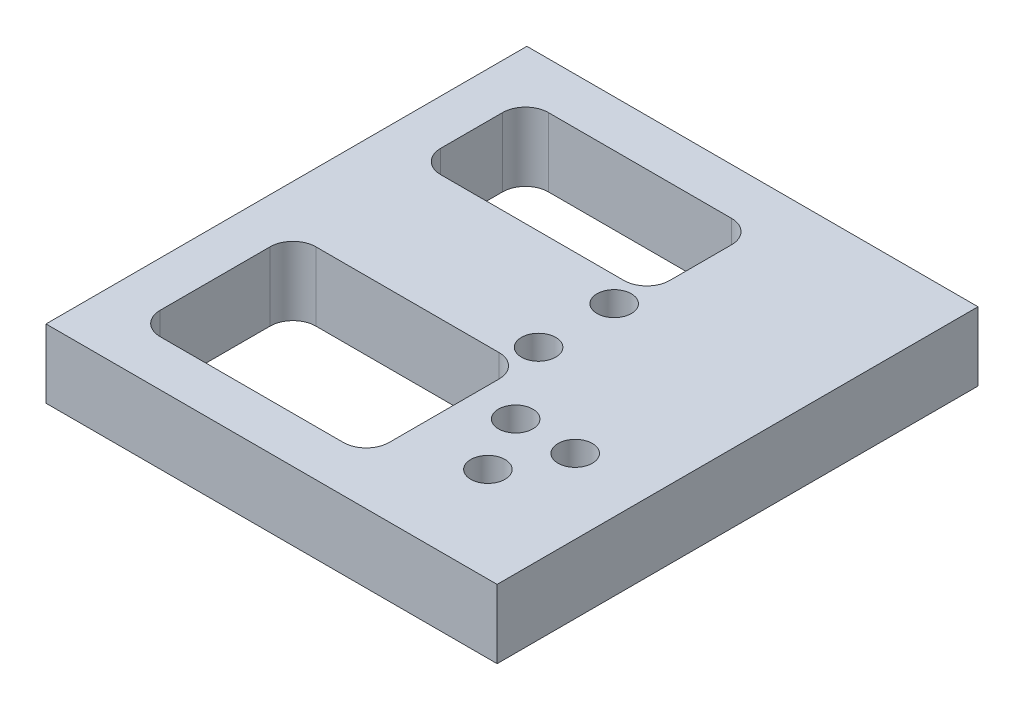
from build123d import *

# Parameters (mm, degrees)
SKETCH1_W           = 197
SKETCH1_H           = 210
BOSS_EXTRUDE1_DEPTH = 30
CUT_EXTRUDE2_REACH  = 149.062
SKETCH3_R           = 7.5
SKETCH4_R           = 9
CUT_EXTRUDE3_DEPTH  = 5


with BuildPart() as part:
    # Sketch1 → Boss-Extrude1 (new body)
    with BuildSketch(Plane(origin=(0, 0, 0), x_dir=(1, 0, 0), z_dir=(0, 1, 0))):
        Rectangle(SKETCH1_W, SKETCH1_H)
    extrude(amount=-BOSS_EXTRUDE1_DEPTH)

    # Sketch3 → Cut-Extrude2 (cut, up to next)
    with BuildSketch(Plane(origin=(0, 0, 0), x_dir=(1, 0, 0), z_dir=(0, 1, 0)), mode=Mode.PRIVATE) as cut_extrude2_sk1:
        with Locations((17.88, 26.73)):
            Circle(SKETCH3_R)
    cut_extrude2_tool1 = extrude(cut_extrude2_sk1.sketch, amount=-CUT_EXTRUDE2_REACH, mode=Mode.PRIVATE) & part.part
    # Sketch3 → Cut-Extrude2 (cut, up to next)
    with BuildSketch(Plane(origin=(0, 0, 0), x_dir=(1, 0, 0), z_dir=(0, 1, 0)), mode=Mode.PRIVATE) as cut_extrude2_sk2:
        with Locations((17.88, -6.27)):
            Circle(SKETCH3_R)
    cut_extrude2_tool2 = extrude(cut_extrude2_sk2.sketch, amount=-CUT_EXTRUDE2_REACH, mode=Mode.PRIVATE) & part.part
    # Sketch3 → Cut-Extrude2 (cut, up to next)
    with BuildSketch(Plane(origin=(0, 0, 0), x_dir=(1, 0, 0), z_dir=(0, 1, 0)), mode=Mode.PRIVATE) as cut_extrude2_sk3:
        with Locations((53, -63.53)):
            Circle(SKETCH3_R)
    cut_extrude2_tool3 = extrude(cut_extrude2_sk3.sketch, amount=-CUT_EXTRUDE2_REACH, mode=Mode.PRIVATE) & part.part
    # Sketch3 → Cut-Extrude2 (cut, up to next)
    with BuildSketch(Plane(origin=(0, 0, 0), x_dir=(1, 0, 0), z_dir=(0, 1, 0)), mode=Mode.PRIVATE) as cut_extrude2_sk4:
        with Locations((66, -38.4)):
            Circle(SKETCH3_R)
    cut_extrude2_tool4 = extrude(cut_extrude2_sk4.sketch, amount=-CUT_EXTRUDE2_REACH, mode=Mode.PRIVATE) & part.part
    # Sketch3 → Cut-Extrude2 (cut, up to next)
    with BuildSketch(Plane(origin=(0, 0, 0), x_dir=(1, 0, 0), z_dir=(0, 1, 0)), mode=Mode.PRIVATE) as cut_extrude2_sk5:
        with Locations((40, -38.4)):
            Circle(SKETCH3_R)
    cut_extrude2_tool5 = extrude(cut_extrude2_sk5.sketch, amount=-CUT_EXTRUDE2_REACH, mode=Mode.PRIVATE) & part.part
    # Sketch3 → Cut-Extrude2 (cut, up to next)
    with BuildSketch(Plane(origin=(0, 0, 0), x_dir=(1, 0, 0), z_dir=(0, 1, 0)), mode=Mode.PRIVATE) as cut_extrude2_sk6:
        with BuildLine():
            Line((-68.745, 84.63), (11.255, 84.63))
            ThreePointArc((11.255, 84.63), (18.326067812, 81.701067812), (21.255, 74.63))
            Line((21.255, 74.63), (21.255, 47.63))
            ThreePointArc((21.255, 47.63), (18.326067812, 40.558932188), (11.255, 37.63))
            Line((11.255, 37.63), (-68.745, 37.63))
            ThreePointArc((-68.745, 37.63), (-75.816067812, 40.558932188), (-78.745, 47.63))
            Line((-78.745, 47.63), (-78.745, 74.63))
            ThreePointArc((-78.745, 74.63), (-75.816067812, 81.701067812), (-68.745, 84.63))
        make_face()
    cut_extrude2_tool6 = extrude(cut_extrude2_sk6.sketch, amount=-CUT_EXTRUDE2_REACH, mode=Mode.PRIVATE) & part.part
    # Sketch3 → Cut-Extrude2 (cut, up to next)
    with BuildSketch(Plane(origin=(0, 0, 0), x_dir=(1, 0, 0), z_dir=(0, 1, 0)), mode=Mode.PRIVATE) as cut_extrude2_sk7:
        with BuildLine():
            Line((-68.745, -16.9), (11.255, -16.9))
            ThreePointArc((11.255, -16.9), (18.326067812, -19.828932188), (21.255, -26.9))
            Line((21.255, -26.9), (21.255, -74.9))
            ThreePointArc((21.255, -74.9), (18.326067812, -81.971067812), (11.255, -84.9))
            Line((11.255, -84.9), (-68.745, -84.9))
            ThreePointArc((-68.745, -84.9), (-75.816067812, -81.971067812), (-78.745, -74.9))
            Line((-78.745, -74.9), (-78.745, -26.9))
            ThreePointArc((-78.745, -26.9), (-75.816067812, -19.828932188), (-68.745, -16.9))
        make_face()
    cut_extrude2_tool7 = extrude(cut_extrude2_sk7.sketch, amount=-CUT_EXTRUDE2_REACH, mode=Mode.PRIVATE) & part.part
    add(cut_extrude2_tool1.solids().sort_by_distance((17.88, 0, -26.73))[0], mode=Mode.SUBTRACT)
    add(cut_extrude2_tool2.solids().sort_by_distance((17.88, 0, 6.27))[0], mode=Mode.SUBTRACT)
    add(cut_extrude2_tool3.solids().sort_by_distance((53, 0, 63.53))[0], mode=Mode.SUBTRACT)
    add(cut_extrude2_tool4.solids().sort_by_distance((66, 0, 38.4))[0], mode=Mode.SUBTRACT)
    add(cut_extrude2_tool5.solids().sort_by_distance((40, 0, 38.4))[0], mode=Mode.SUBTRACT)
    add(cut_extrude2_tool6.solids().sort_by_distance((-28.745, 0, -61.13))[0], mode=Mode.SUBTRACT)
    add(cut_extrude2_tool7.solids().sort_by_distance((-28.745, 0, 50.9))[0], mode=Mode.SUBTRACT)

    # Sketch4 → Cut-Extrude3 (cut)
    with BuildSketch(Plane.XZ.offset(30)):
        with Locations((17.88, -26.73)):
            Circle(SKETCH4_R)
        with Locations((17.88, 6.27)):
            Circle(SKETCH4_R)
        with Locations((40, 38.4)):
            Circle(SKETCH4_R)
        with Locations((66, 38.4)):
            Circle(SKETCH4_R)
        with Locations((53, 63.53)):
            Circle(SKETCH4_R)
    extrude(amount=-CUT_EXTRUDE3_DEPTH, mode=Mode.SUBTRACT)


solid = part.part
